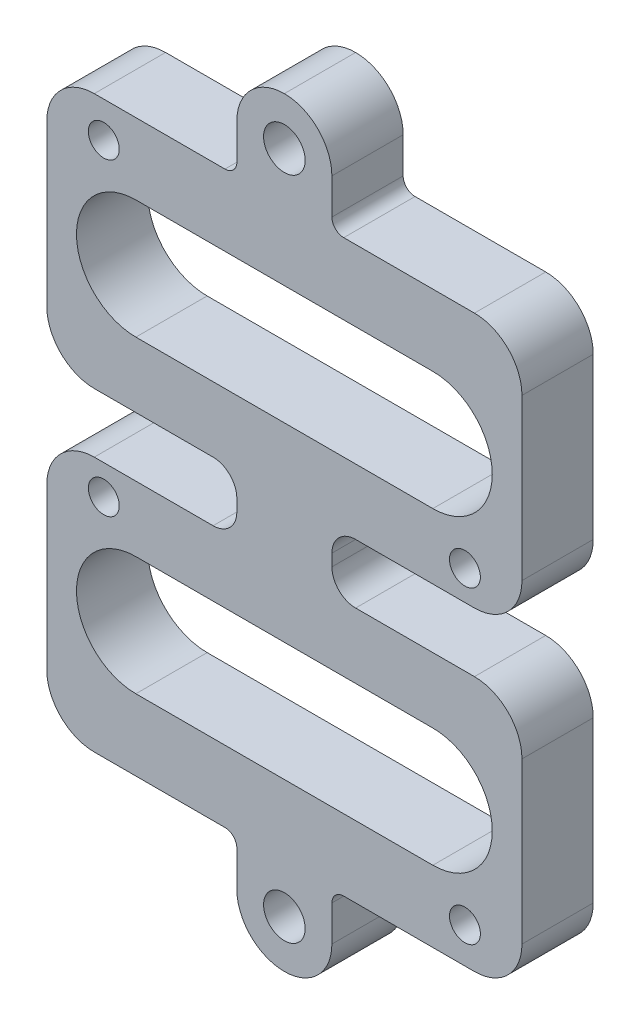
from build123d import *

# Parameters (mm, degrees)
SKETCH1_W           = 40
SKETCH1_H           = 64
BOSS_EXTRUDE1_DEPTH = 3
SKETCH3_R           = 1.3
CUT_EXTRUDE2_DEPTH  = 39.209946349
SKETCH4_R           = 1.75
CUT_EXTRUDE3_DEPTH  = 39.209946349
SKETCH5_W           = 16
SKETCH5_H           = 5
SKETCH5_H_2         = 8
CUT_EXTRUDE4_DEPTH  = 39.209946349
FILLET1_R           = 2
FILLET2_R           = 4
FILLET3_R           = 1


with BuildPart() as part:
    # Sketch1 → Boss-Extrude1 (new, symmetric)
    with BuildSketch(Plane.XY):
        Rectangle(SKETCH1_W, SKETCH1_H)
    extrude(amount=BOSS_EXTRUDE1_DEPTH, both=True)

    # Sketch3 → Cut-Extrude2 (cut, through all)
    with BuildSketch(Plane.XY.offset(3)):
        with Locations((-15.2, 21)):
            Circle(SKETCH3_R)
        with Locations((15.2, 5)):
            Circle(SKETCH3_R)
        with Locations((-15.2, -5)):
            Circle(SKETCH3_R)
        with Locations((15.2, -21)):
            Circle(SKETCH3_R)
    extrude(amount=-CUT_EXTRUDE2_DEPTH, mode=Mode.SUBTRACT)

    # Sketch4 → Cut-Extrude3 (cut, through all)
    with BuildSketch(Plane.XY.offset(3)):
        with Locations((0, -28)):
            Circle(SKETCH4_R)
        with Locations(Location((0, 28, 0), (0, 0, 180))):
            Circle(SKETCH4_R)
    extrude(amount=-CUT_EXTRUDE3_DEPTH, mode=Mode.SUBTRACT)

    # Sketch5 → Cut-Extrude4 (cut, through all)
    with BuildSketch(Plane.XY.offset(3)):
        with Locations((-12, 0)):
            Rectangle(SKETCH5_W, SKETCH5_H)
        with Locations((12, 0)):
            Rectangle(SKETCH5_W, SKETCH5_H)
        with Locations((12, -28)):
            Rectangle(SKETCH5_W, SKETCH5_H_2)
        with Locations((-12, -28)):
            Rectangle(SKETCH5_W, SKETCH5_H_2)
        with Locations((12, 28)):
            Rectangle(SKETCH5_W, SKETCH5_H_2)
        with Locations((-12, 28)):
            Rectangle(SKETCH5_W, SKETCH5_H_2)
        with BuildLine():
            Line((12.5, -18), (-12.5, -18))
            ThreePointArc((-12.5, -18), (-17.5, -13), (-12.5, -8))
            Line((-12.5, -8), (12.5, -8))
            ThreePointArc((12.5, -8), (17.5, -13), (12.5, -18))
        make_face()
        with BuildLine():
            Line((12.5, 18), (-12.5, 18))
            ThreePointArc((-12.5, 18), (-17.5, 13), (-12.5, 8))
            Line((-12.5, 8), (12.5, 8))
            ThreePointArc((12.5, 8), (17.5, 13), (12.5, 18))
        make_face()
    extrude(amount=-CUT_EXTRUDE4_DEPTH, mode=Mode.SUBTRACT)

    # Fillet1
    fillet1_edges = [part.edges().sort_by_distance(p)[0] for p in [
        (4, -2.5, 0),
        (4, 2.5, 0),
        (-4, 2.5, 0),
        (-4, -2.5, 0),
    ]]
    fillet(fillet1_edges, radius=FILLET1_R)

    # Fillet2
    fillet2_edges = [part.edges().sort_by_distance(p)[0] for p in [
        (4, -32, 0),
        (-4, -32, 0),
        (-4, 32, 0),
        (4, 32, 0),
        (20, 24, 0),
        (20, 2.5, 0),
        (-20, 24, 0),
        (-20, 2.5, 0),
        (-20, -24, 0),
        (-20, -2.5, 0),
        (20, -24, 0),
        (20, -2.5, 0),
    ]]
    fillet(fillet2_edges, radius=FILLET2_R - 0.0001)  # a hair under: the kernel refuses the full size

    # Fillet3
    fillet3_edges = [part.edges().sort_by_distance(p)[0] for p in [
        (4, 24, 0),
        (4, -24, 0),
        (-4, -24, 0),
        (-4, 24, 0),
    ]]
    fillet(fillet3_edges, radius=FILLET3_R)


solid = part.part
